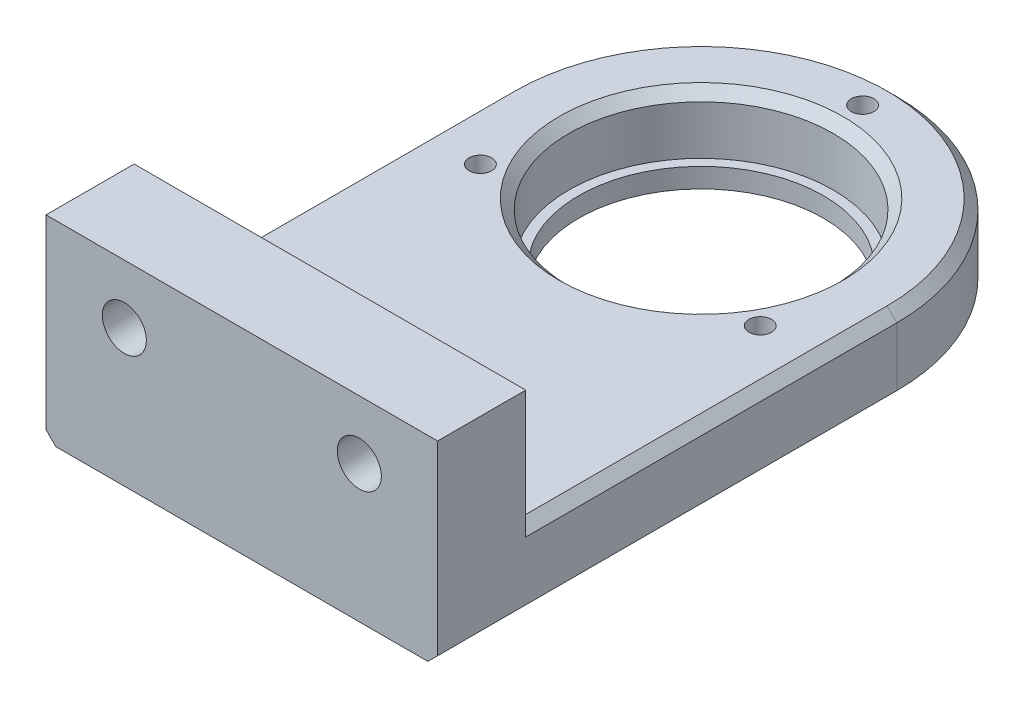
from build123d import *

# Parameters (mm, degrees)
ESQUISSE1_R                  = 1.15
ESQUISSE1_R_2                = 13.5
BOSS_EXTRU_1_DEPTH           = 8
ESQUISSE2_R                  = 13.5
ESQUISSE2_R_2                = 12.5
BOSS_EXTRU_2_DEPTH           = 2
ENL_V_MAT_EXTRU_1_DEPTH      = 3
R_P_TITION_CIRCULAIRE1_COUNT = 3
ESQUISSE4_W                  = 10
ESQUISSE4_H                  = 20
BOSS_EXTRU_3_DEPTH           = 40
PER_AGEAVANC_1_OUTLINE_R     = 2.25
PER_AGEAVANC_1_DEPTH         = 2.45
PER_AGEAVANC_1_DRAFT         = 45
PER_AGEAVANC_1_2_OUTLINE_R   = 2.25
PER_AGEAVANC_1_2_DEPTH       = 2.45
PER_AGEAVANC_1_2_DRAFT       = 45
ESQUISSE7_R                  = 2.25
ENL_V_MAT_EXTRU_2_DEPTH      = 66.754160325
CHANFREIN1_SIZE              = 1


# Read off the part's stored shape, not the designer's step: PerçageAvancé1
with BuildPart() as part:
    # Esquisse1 → Boss.-Extru.1 (new body)
    with BuildSketch(Plane(origin=(0, 0, 0), x_dir=(1, 0, 0), z_dir=(0, 1, 0))):
        with BuildLine():
            Line((20, -46.91), (20, 0))
            ThreePointArc((20, 0), (0, 20), (-20, 0))
            Line((-20, 0), (-20, -46.91))
            Line((-20, -46.91), (20, -46.91))
        make_face()
        with Locations(Location((0, 16.5, 0), (0, 0, 270))):
            Circle(ESQUISSE1_R, mode=Mode.SUBTRACT)
        with Locations(Location((-14.289419162, -8.25, 0), (0, 0, 270))):
            Circle(ESQUISSE1_R, mode=Mode.SUBTRACT)
        with Locations(Location((0, 0, 0), (0, 0, 270))):
            Circle(ESQUISSE1_R_2, mode=Mode.SUBTRACT)
        with Locations(Location((14.289419162, -8.25, 0), (0, 0, 270))):
            Circle(ESQUISSE1_R, mode=Mode.SUBTRACT)
    extrude(amount=BOSS_EXTRU_1_DEPTH)

    # Esquisse2 → Boss.-Extru.2 (add)
    with BuildSketch(Plane.XZ):
        with Locations(Location((0, 0, 0), (0, 0, 270))):
            Circle(ESQUISSE2_R)
        with Locations(Location((0, 0, 0), (0, 0, 270))):
            Circle(ESQUISSE2_R_2, mode=Mode.SUBTRACT)
    extrude(amount=-BOSS_EXTRU_2_DEPTH)

    # Esquisse3 → Enlèv. mat.-Extru.1 (cut)
    with BuildSketch(Plane.XZ):
        Polygon((-14.289419162, 5.882863896), (-12.239419162, 7.066431948), (-12.239419162, 9.433568052), (-14.289419162, 10.617136104), (-16.339419162, 9.433568052), (-16.339419162, 7.066431948), align=None)
    enl_v_mat_extru_1 = extrude(amount=-ENL_V_MAT_EXTRU_1_DEPTH, mode=Mode.SUBTRACT)

    # Répétition circulaire1: Enlèv. mat.-Extru.1 ×3 about axis
    r_p_tition_circulaire1_axis = Axis((0, 0, 0), (0, 1, 0))
    for i in range(1, R_P_TITION_CIRCULAIRE1_COUNT):
        add(enl_v_mat_extru_1.rotate(r_p_tition_circulaire1_axis, i * 360 / R_P_TITION_CIRCULAIRE1_COUNT), mode=Mode.SUBTRACT)

    # Esquisse4 → Boss.-Extru.3 (add)
    with BuildSketch(Plane.ZY.offset(20)):
        with Locations((41.91, 10)):
            Rectangle(ESQUISSE4_W, ESQUISSE4_H)
    extrude(amount=-BOSS_EXTRU_3_DEPTH)


with BuildPart() as per_ageavanc_1_tool:
    # PerçageAvancé1 outline → PerçageAvancé1 (with draft: the straight prism first)
    with BuildSketch(Plane.XY.offset(39.36)):
        with Locations((-12, 14)):
            Circle(PER_AGEAVANC_1_OUTLINE_R)
    extrude(amount=-PER_AGEAVANC_1_DEPTH)
    # PerçageAvancé1: the draft: its side faces are tilted about the plane it starts from
    per_ageavanc_1_sides = [per_ageavanc_1_tool.faces().sort_by_distance(p)[0] for p in [
        (-14.25, 14, 38.135),
    ]]
    draft(per_ageavanc_1_sides, Plane.XY.offset(39.36), PER_AGEAVANC_1_DRAFT)


with BuildPart() as part_1:
    add(part.part)

    # PerçageAvancé1: cut by per_ageavanc_1_tool
    add(per_ageavanc_1_tool.part, mode=Mode.SUBTRACT)


with BuildPart() as per_ageavanc_1_2_tool:
    # Per_ageAvanc_1 2 outline → Per_ageAvanc_1 2 (with draft: the straight prism first)
    with BuildSketch(Plane.XY.offset(39.36)):
        with Locations((12, 14)):
            Circle(PER_AGEAVANC_1_2_OUTLINE_R)
    extrude(amount=-PER_AGEAVANC_1_2_DEPTH)
    # Per_ageAvanc_1 2: the draft: its side faces are tilted about the plane it starts from
    per_ageavanc_1_2_sides = [per_ageavanc_1_2_tool.faces().sort_by_distance(p)[0] for p in [
        (9.75, 14, 38.135),
    ]]
    draft(per_ageavanc_1_2_sides, Plane.XY.offset(39.36), PER_AGEAVANC_1_2_DRAFT)


with BuildPart() as part_2:
    add(part_1.part)

    # Per_ageAvanc_1 2: cut by per_ageavanc_1_2_tool
    add(per_ageavanc_1_2_tool.part, mode=Mode.SUBTRACT)

    # Esquisse7 → Enlèv. mat.-Extru.2 (cut, through all)
    with BuildSketch(Plane(origin=(0, 0, 39.36), x_dir=(-1, 0, 0), z_dir=(0, 0, -1))):
        with Locations((-12, 14)):
            Circle(ESQUISSE7_R)
        with Locations((12, 14)):
            Circle(ESQUISSE7_R)
    extrude(amount=-ENL_V_MAT_EXTRU_2_DEPTH, mode=Mode.SUBTRACT)

    # Chanfrein1
    chanfrein1_edges = [part_2.edges().sort_by_distance(p)[0] for p in [
        (20, 8, 18.455),
        (20, 14, 36.91),
        (0, 20, 36.91),
        (-20, 14, 36.91),
        (-20, 8, 18.455),
        (0, 8, -20),
        (0, 0, -20),
        (0, 8, -13.5),
        (20, 0, 23.455),
        (-20, 0, 23.455),
    ]]
    chamfer(chanfrein1_edges, length=CHANFREIN1_SIZE)


solid = part_2.part
